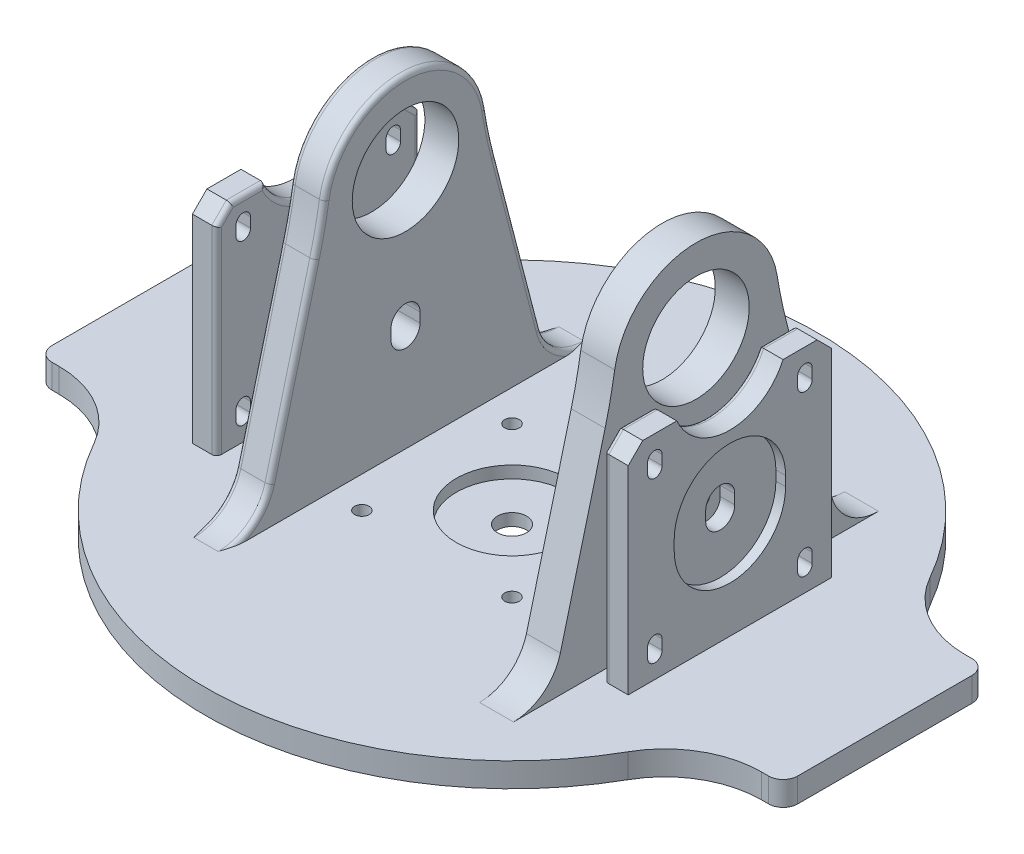
from build123d import *

# Parameters (mm, degrees)
SKETCH1_R            = 3
SKETCH1_R_2          = 1.5
BOSS_EXTRUDE1_DEPTH  = 5
SKETCH2_R            = 11.5
CUT_EXTRUDE1_DEPTH   = 2.5
SKETCH3_W            = 5
SKETCH3_H            = 42
BOSS_EXTRUDE2_DEPTH  = 44
SKETCH4_R            = 12
CUT_EXTRUDE3_DEPTH   = 146.938607128
CUT_EXTRUDE4_DEPTH   = 2
CUT_EXTRUDE5_START   = -2
CUT_EXTRUDE5_DEPTH   = 2
SKETCH8_W            = 7
SKETCH8_H            = 59.914396534
BOSS_EXTRUDE3_DEPTH  = 70
SKETCH9_R            = 11
CUT_EXTRUDE6_DEPTH   = 8
FILLET1_R            = 10
FILLET2_R            = 1
FILLET1_OF_MIRROR1_R = 10


with BuildPart() as part:
    # Sketch1 → Boss-Extrude1 (new body)
    with BuildSketch(Plane(origin=(0, 0, 0), x_dir=(1, 0, 0), z_dir=(0, 1, 0))):
        with BuildLine():
            Line((74, 21), (72.567424721, 21))
            ThreePointArc((72.567424721, 21), (62.486833417, 23.726272002), (55.154485497, 31.161832104))
            ThreePointArc((55.154485497, 31.161832104), (0, 63.348852006), (-55.154485497, 31.161832104))
            ThreePointArc((-55.154485497, 31.161832104), (-62.486833417, 23.726272002), (-72.567424721, 21))
            Line((-72.567424721, 21), (-74, 21))
            ThreePointArc((-74, 21), (-76.121320344, 20.121320344), (-77, 18))
            Line((-77, 18), (-77, -18))
            ThreePointArc((-77, -18), (-76.121320344, -20.121320344), (-74, -21))
            Line((-74, -21), (-72.567424721, -21))
            ThreePointArc((-72.567424721, -21), (-62.486833417, -23.726272002), (-55.154485497, -31.161832104))
            ThreePointArc((-55.154485497, -31.161832104), (0, -63.348852006), (55.154485497, -31.161832104))
            ThreePointArc((55.154485497, -31.161832104), (62.486833417, -23.726272002), (72.567424721, -21))
            Line((72.567424721, -21), (74, -21))
            ThreePointArc((74, -21), (76.121320344, -20.121320344), (77, -18))
            Line((77, -18), (77, 18))
            ThreePointArc((77, 18), (76.121320344, 20.121320344), (74, 21))
        make_face()
        with Locations(Location((0, 0, 0), (0, 0, 270))):
            Circle(SKETCH1_R, mode=Mode.SUBTRACT)
        with Locations(Location((15.5, 15.5, 0), (0, 0, 270))):
            Circle(SKETCH1_R_2, mode=Mode.SUBTRACT)
        with Locations(Location((15.5, -15.5, 0), (0, 0, 270))):
            Circle(SKETCH1_R_2, mode=Mode.SUBTRACT)
        with Locations(Location((-15.5, -15.5, 0), (0, 0, 270))):
            Circle(SKETCH1_R_2, mode=Mode.SUBTRACT)
        with Locations(Location((-15.5, 15.5, 0), (0, 0, 270))):
            Circle(SKETCH1_R_2, mode=Mode.SUBTRACT)
    extrude(amount=BOSS_EXTRUDE1_DEPTH)

    # Sketch2 → Cut-Extrude1 (cut)
    with BuildSketch(Plane(origin=(0, 5, 0), x_dir=(1, 0, 0), z_dir=(0, 1, 0))):
        with Locations(Location((0, 0, 0), (0, 0, 270))):
            Circle(SKETCH2_R)
    extrude(amount=-CUT_EXTRUDE1_DEPTH, mode=Mode.SUBTRACT)

    # Sketch3 → Boss-Extrude2 (add)
    with BuildSketch(Plane(origin=(0, 5, 0), x_dir=(1, 0, 0), z_dir=(0, 1, 0))):
        with Locations((42.5, 0)):
            Rectangle(SKETCH3_W, SKETCH3_H)
        with Locations((-42.5, 0)):
            Rectangle(SKETCH3_W, SKETCH3_H)
    extrude(amount=BOSS_EXTRUDE2_DEPTH)

    # Sketch4 → Cut-Extrude3 (cut, through all)
    with BuildSketch(Plane.ZY.offset(45)):
        with Locations((0, 53.86)):
            Circle(SKETCH4_R)
        Polygon((18, 49), (21, 46), (21, 49), align=None)
        Polygon((-21, 46), (-21, 49), (-18, 49), align=None)
        with BuildLine():
            Line((-17, 44.5), (-17, 42.5))
            ThreePointArc((-17, 42.5), (-15.5, 41), (-14, 42.5))
            Line((-14, 42.5), (-14, 44.5))
            ThreePointArc((-14, 44.5), (-15.5, 46), (-17, 44.5))
        make_face()
        with BuildLine():
            Line((17, 44.5), (17, 42.5))
            ThreePointArc((17, 42.5), (15.5, 41), (14, 42.5))
            Line((14, 42.5), (14, 44.5))
            ThreePointArc((14, 44.5), (15.5, 46), (17, 44.5))
        make_face()
        with BuildLine():
            Line((-17, 9.5), (-17, 11.5))
            ThreePointArc((-17, 11.5), (-15.5, 13), (-14, 11.5))
            Line((-14, 11.5), (-14, 9.5))
            ThreePointArc((-14, 9.5), (-15.5, 8), (-17, 9.5))
        make_face()
        with BuildLine():
            Line((14, 9.5), (14, 11.5))
            ThreePointArc((14, 11.5), (15.5, 13), (17, 11.5))
            Line((17, 11.5), (17, 9.5))
            ThreePointArc((17, 9.5), (15.5, 8), (14, 9.5))
        make_face()
        with BuildLine():
            Line((3, 28), (3, 26))
            ThreePointArc((3, 26), (0, 23), (-3, 26))
            Line((-3, 26), (-3, 28))
            ThreePointArc((-3, 28), (0, 31), (3, 28))
        make_face()
    extrude(amount=-CUT_EXTRUDE3_DEPTH, mode=Mode.SUBTRACT)

    # Sketch7 → Cut-Extrude4 (cut)
    with BuildSketch(Plane.ZY.offset(45)):
        with BuildLine():
            Line((-11.5, 28), (-11.5, 26))
            ThreePointArc((-11.5, 26), (0, 14.5), (11.5, 26))
            Line((11.5, 26), (11.5, 28))
            ThreePointArc((11.5, 28), (0, 39.5), (-11.5, 28))
        make_face()
    extrude(amount=-CUT_EXTRUDE4_DEPTH, mode=Mode.SUBTRACT)

    # Sketch6 → Cut-Extrude5 (cut)
    with BuildSketch(Plane(origin=(45, 0, 0), x_dir=(0, 0, -1), z_dir=(1, 0, 0)).offset(CUT_EXTRUDE5_START)):
        with BuildLine():
            Line((11.5, 28), (11.5, 26))
            ThreePointArc((11.5, 26), (0, 14.5), (-11.5, 26))
            Line((-11.5, 26), (-11.5, 28))
            ThreePointArc((-11.5, 28), (0, 39.5), (11.5, 28))
        make_face()
    extrude(amount=CUT_EXTRUDE5_DEPTH, mode=Mode.SUBTRACT)

    # Sketch8 → Boss-Extrude3 (add)
    with BuildSketch(Plane(origin=(0, 5, 0), x_dir=(1, 0, 0), z_dir=(0, 1, 0))):
        with Locations((-25.492732013, 0)):
            Rectangle(SKETCH8_W, SKETCH8_H)
    boss_extrude3 = extrude(amount=BOSS_EXTRUDE3_DEPTH)

    # Sketch9 → Cut-Extrude6 (cut)
    with BuildSketch(Plane.ZY.offset(28.992732013)):
        with BuildLine():
            Line((-18.765519126, 48.066186879), (-29.957198267, 5))
            Line((-29.957198267, 5), (-29.957198267, 75))
            Line((-29.957198267, 75), (29.957198267, 75))
            Line((29.957198267, 75), (29.957198267, 5))
            Line((29.957198267, 5), (18.765519126, 48.066186879))
            ThreePointArc((18.765519126, 48.066186879), (17.66310113, 52.772900891), (16.789431818, 57.527391838))
            ThreePointArc((16.789431818, 57.527391838), (0, 71.86), (-16.789431818, 57.527391838))
            ThreePointArc((-16.789431818, 57.527391838), (-17.66310113, 52.772900891), (-18.765519126, 48.066186879))
        make_face()
        with Locations((0, 54.86)):
            Circle(SKETCH9_R)
        with BuildLine():
            Line((3, 28), (3, 26))
            ThreePointArc((3, 26), (0, 23), (-3, 26))
            Line((-3, 26), (-3, 28))
            ThreePointArc((-3, 28), (0, 31), (3, 28))
        make_face()
    cut_extrude6 = extrude(amount=-CUT_EXTRUDE6_DEPTH, mode=Mode.SUBTRACT)

    # Fillet1
    # the kernel refuses this fillet: 10 mm, written as the material it adds along each edge
    with BuildSketch(Plane(origin=(-21.992732013, 5, -29.957198267), x_dir=(0, 0, -1), z_dir=(-1, 0, 0)), Plane(origin=(-28.992732013, 5, 29.957198267), x_dir=(0, 0, 1), z_dir=(1, 0, 0))) as fillet1_piece_1:
        with BuildLine():
            CenterArc((FILLET1_R * 0.77334340156, -FILLET1_R), FILLET1_R, 90, 75.432674654)
            Line((-FILLET1_R * 0.194509361742, -FILLET1_R * 0.748482548181), (0, 0))
            Line((0, 0), (FILLET1_R * 0.77334340156, 0))
        make_face()
    extrude(amount=7)

    # Fillet2
    # the kernel refuses this fillet: 1 mm, written as the material it takes off along each edge
    with BuildSketch(Plane(origin=(40, 5, -21), x_dir=(1, 0, 0), z_dir=(0, 1, 0)), Plane(origin=(-40, 5, 21), x_dir=(-1, 0, 0), z_dir=(0, 1, 0)), Plane(origin=(-40, 5, -21), x_dir=(0, 0, 1), z_dir=(0, 1, 0))) as fillet2_piece_1:
        with BuildLine():
            CenterArc((FILLET2_R, -FILLET2_R), FILLET2_R, 90, 90)
            Line((0, -FILLET2_R), (0, 0))
            Line((0, 0), (FILLET2_R, 0))
        make_face()
    extrude(amount=43.5, mode=Mode.SUBTRACT)
    with BuildSketch(Plane(origin=(40, 44.232233047, -22.767766953), x_dir=(1, 0, 0), z_dir=(0, 0.7071067811865505, 0.7071067811865447)), Plane(origin=(-40, 44.232233047, 22.767766953), x_dir=(-1, 0, 0), z_dir=(0, 0.7071067811865505, -0.7071067811865447))) as fillet2_piece_2:
        with BuildLine():
            CenterArc((FILLET2_R, -FILLET2_R), FILLET2_R, 90, 90)
            Line((0, -FILLET2_R), (0, 0))
            Line((0, 0), (FILLET2_R, 0))
        make_face()
    extrude(amount=9.242640687, mode=Mode.SUBTRACT)
    with BuildSketch(Plane(origin=(-40, 44.232233047, -22.767766953), x_dir=(-1, 0, 0), z_dir=(0, 0.7071067811865505, 0.7071067811865447)), Plane(origin=(40, 44.232233047, 22.767766953), x_dir=(1, 0, 0), z_dir=(0, 0.7071067811865505, -0.7071067811865447))) as fillet2_piece_3:
        with BuildLine():
            CenterArc((FILLET2_R, FILLET2_R), FILLET2_R, 180, 90)
            Line((0, FILLET2_R), (0, 0))
            Line((0, 0), (FILLET2_R, 0))
        make_face()
    extrude(amount=9.242640687, mode=Mode.SUBTRACT)
    with BuildSketch(Plane(origin=(-40, 49, 8.471800217), x_dir=(-1, 0, 0), z_dir=(0, 0, 1)), Plane(origin=(-40, 49, -20.5), x_dir=(-1, 0, 0), z_dir=(0, 0, 1))) as fillet2_piece_4:
        with BuildLine():
            CenterArc((FILLET2_R, FILLET2_R), FILLET2_R, 180, 90)
            Line((0, FILLET2_R), (0, 0))
            Line((0, 0), (FILLET2_R, 0))
        make_face()
    extrude(amount=12.028199783, mode=Mode.SUBTRACT)
    with BuildSketch(Plane(origin=(40, 5, 21), x_dir=(1, 0, 0), z_dir=(0, 1, 0))) as fillet2_piece_5:
        with BuildLine():
            CenterArc((FILLET2_R, FILLET2_R), FILLET2_R, 180, 90)
            Line((0, FILLET2_R), (0, 0))
            Line((0, 0), (FILLET2_R, 0))
        make_face()
    extrude(amount=43.5, mode=Mode.SUBTRACT)
    with BuildSketch(Plane(origin=(40, 49, 8.471800217), x_dir=(1, 0, 0), z_dir=(0, 0, 1)), Plane(origin=(40, 49, -20.5), x_dir=(1, 0, 0), z_dir=(0, 0, 1))) as fillet2_piece_6:
        with BuildLine():
            CenterArc((FILLET2_R, -FILLET2_R), FILLET2_R, 90, 90)
            Line((0, -FILLET2_R), (0, 0))
            Line((0, 0), (FILLET2_R, 0))
        make_face()
    extrude(amount=12.028199783, mode=Mode.SUBTRACT)
    with BuildSketch(Plane(origin=(-40, 53.86, 0), x_dir=(0, -0.20695820056351974, -0.9783497857205826), z_dir=(0, 0.9783497857205826, -0.20695820056351974))) as fillet2_piece_7:
        with BuildLine():
            CenterArc((12 + FILLET2_R, FILLET2_R), FILLET2_R, 180, 90)
            Line((12 + FILLET2_R, 0), (12, 0))
            Line((12, 0), (12, FILLET2_R))
        make_face()
    revolve(axis=Axis((-40, 53.86, 0), (-1, 0, 0)), revolution_arc=156.111691359, mode=Mode.SUBTRACT)
    with BuildSketch(Plane(origin=(40, 53.86, 0), x_dir=(0, -0.20695820056351974, -0.9783497857205826), z_dir=(0, 0.9783497857205826, -0.20695820056351974))) as fillet2_piece_8:
        with BuildLine():
            CenterArc((12 + FILLET2_R, -FILLET2_R), FILLET2_R, 90, 90)
            Line((12 + FILLET2_R, 0), (12, 0))
            Line((12, 0), (12, -FILLET2_R))
        make_face()
    revolve(axis=Axis((40, 53.86, 0), (-1, 0, 0)), revolution_arc=156.111691359, mode=Mode.SUBTRACT)
    with BuildSketch(Plane(origin=(-28.992732013, 48.066186879, -18.765519126), x_dir=(3.5171865420124964e-13, -0.25151745181932866, 0.9678527633014805), z_dir=(0, -0.9678527633014805, -0.25151745181932866)), Plane(origin=(-21.992732013, 12.484825482, 28.01210465), x_dir=(-1, 0, 0), z_dir=(0, 0.9678527633014804, -0.25151745181932933)), Plane(origin=(-28.992732013, 12.484825482, 28.01210465), x_dir=(3.517186542012512e-13, -0.25151745181932933, -0.9678527633014804), z_dir=(0, 0.9678527633014804, -0.25151745181932933))) as fillet2_piece_9:
        with BuildLine():
            CenterArc((FILLET2_R, -FILLET2_R), FILLET2_R, 90, 90)
            Line((0, -FILLET2_R), (0, 0))
            Line((0, 0), (FILLET2_R, 0))
        make_face()
    extrude(amount=36.763196579, mode=Mode.SUBTRACT)
    with BuildSketch(Plane(origin=(-28.992732013, 73.217932061, 115.550795456), x_dir=(0, -0.2515174518193321, -0.9678527633014797), z_dir=(0, -0.9678527633014797, 0.2515174518193321))) as fillet2_piece_10:
        with BuildLine():
            CenterArc((100 + FILLET2_R, FILLET2_R), FILLET2_R, 180, 90)
            Line((100, FILLET2_R), (100, 0))
            Line((100, 0), (100 + FILLET2_R, 0))
        make_face()
    revolve(axis=Axis((-28.992732013, 73.217932061, 115.550795456), (1, 0, 0)), revolution_arc=5.540005257, mode=Mode.SUBTRACT)
    with BuildSketch(Plane(origin=(-28.992732013, 54.86, 0), x_dir=(0, 0.15690540223008545, 0.9876136363735645), z_dir=(0, -0.9876136363735645, 0.15690540223008545))) as fillet2_piece_11:
        with BuildLine():
            CenterArc((17 - FILLET2_R, -FILLET2_R), FILLET2_R, 0, 90)
            Line((17, -FILLET2_R), (17, 0))
            Line((17, 0), (17 - FILLET2_R, 0))
        make_face()
    revolve(axis=Axis((-28.992732013, 54.86, 0), (-1, 0, 0)), revolution_arc=161.945359822, mode=Mode.SUBTRACT)
    with BuildSketch(Plane(origin=(-21.992732013, 73.217932061, -115.550795456), x_dir=(0, -0.2515174518193243, 0.9678527633014816), z_dir=(0, -0.9678527633014816, -0.2515174518193243))) as fillet2_piece_12:
        with BuildLine():
            CenterArc((100 + FILLET2_R, FILLET2_R), FILLET2_R, 180, 90)
            Line((100 + FILLET2_R, 0), (100, 0))
            Line((100, 0), (100, FILLET2_R))
        make_face()
    revolve(axis=Axis((-21.992732013, 73.217932061, -115.550795456), (-1, 0, 0)), revolution_arc=5.540005257, mode=Mode.SUBTRACT)
    with BuildSketch(Plane(origin=(-21.992732013, 48.066186879, -18.765519126), x_dir=(3.5171865420124964e-13, -0.25151745181932866, 0.9678527633014805), z_dir=(0, -0.9678527633014805, -0.25151745181932866))) as fillet2_piece_13:
        with BuildLine():
            CenterArc((FILLET2_R, FILLET2_R), FILLET2_R, 180, 90)
            Line((0, FILLET2_R), (0, 0))
            Line((0, 0), (FILLET2_R, 0))
        make_face()
    extrude(amount=36.763196579, mode=Mode.SUBTRACT)
    with BuildSketch(Plane(origin=(-21.992732013, 73.217932061, 115.550795456), x_dir=(0, -0.15690540223008106, -0.987613636373565), z_dir=(0, 0.987613636373565, -0.15690540223008106))) as fillet2_piece_14:
        with BuildLine():
            CenterArc((100 + FILLET2_R, FILLET2_R), FILLET2_R, 180, 90)
            Line((100 + FILLET2_R, 0), (100, 0))
            Line((100, 0), (100, FILLET2_R))
        make_face()
    revolve(axis=Axis((-21.992732013, 73.217932061, 115.550795456), (-1, 0, 0)), revolution_arc=5.540005257, mode=Mode.SUBTRACT)
    with BuildSketch(Plane(origin=(-21.992732013, 54.86, 0), x_dir=(0, 0.15690540223008545, 0.9876136363735645), z_dir=(0, -0.9876136363735645, 0.15690540223008545))) as fillet2_piece_15:
        with BuildLine():
            CenterArc((17 - FILLET2_R, FILLET2_R), FILLET2_R, 270, 90)
            Line((17 - FILLET2_R, 0), (17, 0))
            Line((17, 0), (17, FILLET2_R))
        make_face()
    revolve(axis=Axis((-21.992732013, 54.86, 0), (-1, 0, 0)), revolution_arc=161.945359822, mode=Mode.SUBTRACT)
    with BuildSketch(Plane(origin=(-28.992732013, 73.217932061, -115.550795456), x_dir=(0, -0.15690540223009855, 0.9876136363735624), z_dir=(0, 0.9876136363735624, 0.15690540223009855))) as fillet2_piece_16:
        with BuildLine():
            CenterArc((100 + FILLET2_R, FILLET2_R), FILLET2_R, 180, 90)
            Line((100, FILLET2_R), (100, 0))
            Line((100, 0), (100 + FILLET2_R, 0))
        make_face()
    revolve(axis=Axis((-28.992732013, 73.217932061, -115.550795456), (1, 0, 0)), revolution_arc=5.540005257, mode=Mode.SUBTRACT)
    with BuildSketch(Plane(origin=(-21.992732013, 15, 37.690632283), x_dir=(0, -0.9688949669075975, 0.24747230774598988), z_dir=(0, 0.24747230774598988, 0.9688949669075975))) as fillet2_piece_17_section:
        with BuildLine():
            CenterArc((10 + FILLET2_R, -FILLET2_R), FILLET2_R, 90, 90)
            Line((10 + FILLET2_R, 0), (10, 0))
            Line((10, 0), (10, -FILLET2_R))
        make_face()
    fillet2_piece_17 = revolve(axis=Axis((-21.992732013, 15, 37.690632283), (1, 0, 0)), revolution_arc=89.760661296, mode=Mode.PRIVATE)
    fillet2_piece_17 = split(fillet2_piece_17, bisect_by=Plane(origin=(-22.27663379, 5, 31.399428377), z_dir=(0, 1, 0)), keep=Keep.TOP, mode=Mode.PRIVATE)
    add(fillet2_piece_17, mode=Mode.SUBTRACT)
    with BuildSketch(Plane(origin=(-28.992732013, 15, 37.690632283), x_dir=(0, -0.9688949669075975, 0.24747230774598988), z_dir=(0, 0.24747230774598988, 0.9688949669075975))) as fillet2_piece_18_section:
        with BuildLine():
            CenterArc((10 + FILLET2_R, FILLET2_R), FILLET2_R, 180, 90)
            Line((10, FILLET2_R), (10, 0))
            Line((10, 0), (10 + FILLET2_R, 0))
        make_face()
    fillet2_piece_18 = revolve(axis=Axis((-28.992732013, 15, 37.690632283), (1, 0, 0)), revolution_arc=89.760661296, mode=Mode.PRIVATE)
    fillet2_piece_18 = split(fillet2_piece_18, bisect_by=Plane(origin=(-28.708830235, 5, 31.399428376), z_dir=(0, 1, 0)), keep=Keep.TOP, mode=Mode.PRIVATE)
    add(fillet2_piece_18, mode=Mode.SUBTRACT)
    with BuildSketch(Plane(origin=(-28.992732013, 15, -37.690632283), x_dir=(0, -0.9688949669075975, -0.24747230774598988), z_dir=(0, 0.24747230774598988, -0.9688949669075975))) as fillet2_piece_19_section:
        with BuildLine():
            CenterArc((10 + FILLET2_R, -FILLET2_R), FILLET2_R, 90, 90)
            Line((10 + FILLET2_R, 0), (10, 0))
            Line((10, 0), (10, -FILLET2_R))
        make_face()
    fillet2_piece_19 = revolve(axis=Axis((-28.992732013, 15, -37.690632283), (-1, 0, 0)), revolution_arc=89.760661296, mode=Mode.PRIVATE)
    fillet2_piece_19 = split(fillet2_piece_19, bisect_by=Plane(origin=(-28.708831202, 5, -31.399428859), z_dir=(0, 1, 0)), keep=Keep.TOP, mode=Mode.PRIVATE)
    add(fillet2_piece_19, mode=Mode.SUBTRACT)
    with BuildSketch(Plane(origin=(-21.992732013, 15, -37.690632283), x_dir=(0, -0.9688949669075975, -0.24747230774598988), z_dir=(0, 0.24747230774598988, -0.9688949669075975))) as fillet2_piece_20_section:
        with BuildLine():
            CenterArc((10 + FILLET2_R, FILLET2_R), FILLET2_R, 180, 90)
            Line((10 + FILLET2_R, 0), (10, 0))
            Line((10, 0), (10, FILLET2_R))
        make_face()
    fillet2_piece_20 = revolve(axis=Axis((-21.992732013, 15, -37.690632283), (-1, 0, 0)), revolution_arc=89.760661296, mode=Mode.PRIVATE)
    fillet2_piece_20 = split(fillet2_piece_20, bisect_by=Plane(origin=(-22.276632421, 5, -31.399429106), z_dir=(0, 1, 0)), keep=Keep.TOP, mode=Mode.PRIVATE)
    add(fillet2_piece_20, mode=Mode.SUBTRACT)

    # Mirror1: Boss-Extrude3, Cut-Extrude6 across plane
    add(boss_extrude3.mirror(Plane(origin=(4.5, 0, 0), x_dir=(0, 0, 1), z_dir=(1, 0, 0))))
    add(cut_extrude6.mirror(Plane(origin=(4.5, 0, 0), x_dir=(0, 0, 1), z_dir=(1, 0, 0))), mode=Mode.SUBTRACT)

    # Fillet1 of Mirror1
    # the kernel refuses this fillet: 10 mm, written as the material it adds along each edge
    with BuildSketch(Plane(origin=(30.992732013, 5, -29.957198267), x_dir=(0, 0, -1), z_dir=(1, 0, 0)), Plane(origin=(37.992732013, 5, 29.957198267), x_dir=(0, 0, 1), z_dir=(-1, 0, 0))) as fillet1_of_mirror1_piece_1:
        with BuildLine():
            CenterArc((FILLET1_OF_MIRROR1_R * 0.77334340156, FILLET1_OF_MIRROR1_R), FILLET1_OF_MIRROR1_R, 194.567325346, 75.432674654)
            Line((-FILLET1_OF_MIRROR1_R * 0.194509361742, FILLET1_OF_MIRROR1_R * 0.748482548181), (0, 0))
            Line((0, 0), (FILLET1_OF_MIRROR1_R * 0.77334340156, 0))
        make_face()
    extrude(amount=7)


solid = part.part
